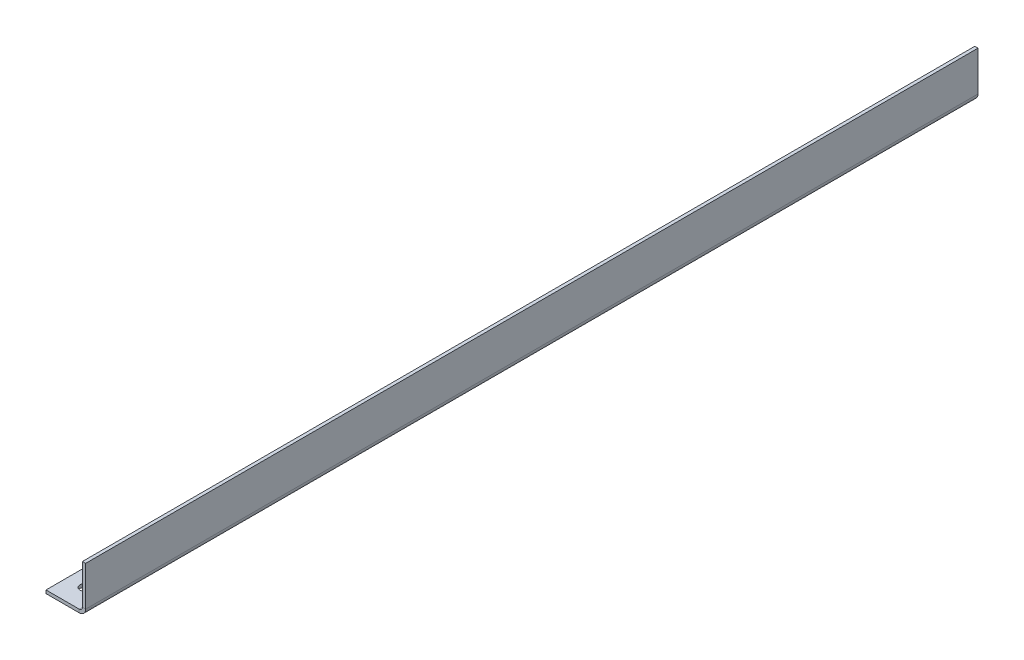
from build123d import *

# Parameters (mm, degrees)
SM_GUIDE_DEPTH  = 416
SK_HOLES_R      = 2.15
CUT_HOLES_DEPTH = 1.5


# Sheet-metal steps are written as plain solids
with BuildPart() as part:
    # SK_Guide → SM_Guide (new body)
    with BuildSketch(Plane.XY.offset(-208)):
        with BuildLine():
            Line((48, 0), (63.5, 0))
            ThreePointArc((63.5, 0), (64.560660172, 0.439339828), (65, 1.5))
            Line((65, 1.5), (65, 20))
            Line((65, 20), (66.5, 20))
            Line((66.5, 20), (66.5, 1.5))
            ThreePointArc((66.5, 1.5), (65.621320344, -0.621320344), (63.5, -1.5))
            Line((63.5, -1.5), (48, -1.5))
            Line((48, -1.5), (48, 0))
        make_face()
    extrude(amount=SM_GUIDE_DEPTH)

    # SK_Holes → CUT_Holes (cut)
    with BuildSketch(Plane(origin=(0, 0, 0), x_dir=(1, 0, 0), z_dir=(0, 1, 0))):
        with Locations(Location((56, -198, 0), (0, 0, 270))):
            Circle(SK_HOLES_R)
        with Locations(Location((56, 198, 0), (0, 0, 270))):
            Circle(SK_HOLES_R)
    extrude(amount=-CUT_HOLES_DEPTH, mode=Mode.SUBTRACT)


solid = part.part
